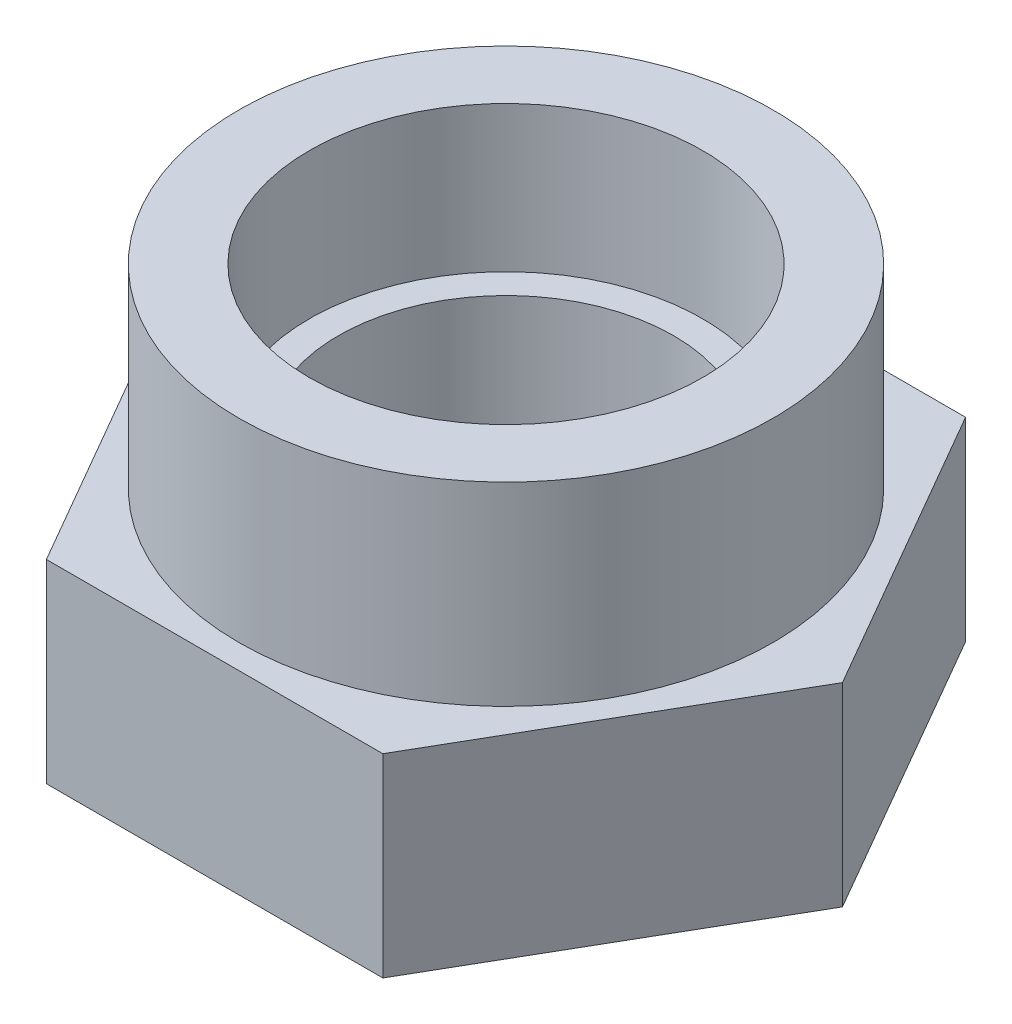
from build123d import *

# Parameters (mm, degrees)
SKETCH1_R           = 3.45
BOSS_EXTRUDE1_DEPTH = 8
SKETCH2_R           = 4.05
CUT_EXTRUDE1_DEPTH  = 3
SKETCH3_R           = 10
SKETCH3_R_2         = 5.5
CUT_EXTRUDE3_DEPTH  = 4


with BuildPart() as part:
    # Sketch1 → Boss-Extrude1 (new body)
    with BuildSketch(Plane(origin=(0, 0, 0), x_dir=(1, 0, 0), z_dir=(0, 1, 0))):
        Polygon((3.464101615, 6), (-3.464101615, 6), (-6.92820323, 0), (-3.464101615, -6), (3.464101615, -6), (6.92820323, 0), align=None)
        Circle(SKETCH1_R, mode=Mode.SUBTRACT)
    extrude(amount=BOSS_EXTRUDE1_DEPTH)

    # Sketch2 → Cut-Extrude1 (cut)
    with BuildSketch(Plane(origin=(0, 8, 0), x_dir=(1, 0, 0), z_dir=(0, 1, 0))):
        Circle(SKETCH2_R)
    extrude(amount=-CUT_EXTRUDE1_DEPTH, mode=Mode.SUBTRACT)

    # Sketch3 → Cut-Extrude3 (cut)
    with BuildSketch(Plane(origin=(0, 8, 0), x_dir=(1, 0, 0), z_dir=(0, 1, 0))):
        Circle(SKETCH3_R)
        Circle(SKETCH3_R_2, mode=Mode.SUBTRACT)
    extrude(amount=-CUT_EXTRUDE3_DEPTH, mode=Mode.SUBTRACT)


solid = part.part
